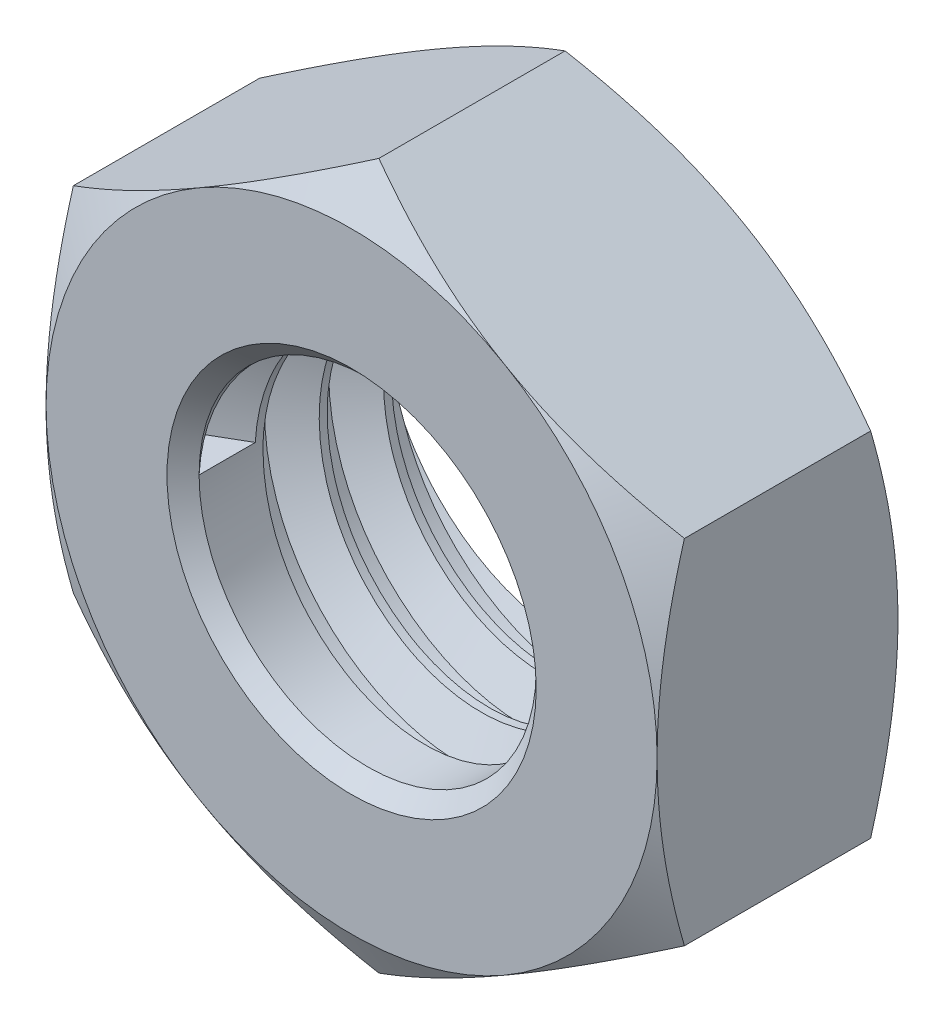
from build123d import *

# Parameters (mm, degrees)
BOSS_EXTRUDE1_DEPTH     = 3
SKETCH2_OUTSIDE_W       = 22.406
SKETCH2_OUTSIDE_H       = 23.584
SKETCH2_OUTSIDE_R       = 3.80618165
CUT_EXTRUDE1_DEPTH      = 3
CUT_EXTRUDE1_DRAFT      = -60
MIRROR1_COPY_1_SKETCH_W = 22.406
MIRROR1_COPY_1_SKETCH_H = 23.584
MIRROR1_COPY_1_SKETCH_R = 3.80618165
MIRROR1_COPY_1_DEPTH    = 3
MIRROR1_COPY_1_DRAFT    = -60
M5X0_8_TAPPED_HOLE1_D   = 4.2
CHAMFER1_SIZE           = 0.2
THREAD1_PITCH           = 0.8


with BuildPart() as part:
    # Sketch1 → Boss-Extrude1 (new body)
    with BuildSketch(Plane.XY):
        Polygon((3.80618165, -2.1975), (3.80618165, 2.1975), (0, 4.395), (-3.80618165, 2.1975), (-3.80618165, -2.1975), (0, -4.395), align=None)
    extrude(amount=BOSS_EXTRUDE1_DEPTH)


with BuildPart() as cut_extrude1_tool:
    # Sketch2 outside → Cut-Extrude1 (with draft: the straight prism first)
    with BuildSketch(Plane(origin=(0, 0, 0), x_dir=(-1, 0, 0), z_dir=(0, 0, -1))):
        Rectangle(SKETCH2_OUTSIDE_W, SKETCH2_OUTSIDE_H)
        Circle(SKETCH2_OUTSIDE_R, mode=Mode.SUBTRACT)
    extrude(amount=-CUT_EXTRUDE1_DEPTH)
    # Cut-Extrude1: the draft: its side faces are tilted about the plane it starts from
    cut_extrude1_sides = [cut_extrude1_tool.faces().sort_by_distance(p)[0] for p in [
        (0, -11.792, 1.5),
        (-11.203, 0, 1.5),
        (0, 11.792, 1.5),
        (11.203, 0, 1.5),
        (3.80618165, 0, 1.5),
    ]]
    draft(cut_extrude1_sides, Plane(origin=(0, 0, 0), x_dir=(-1, 0, 0), z_dir=(0, 0, -1)), CUT_EXTRUDE1_DRAFT)


with BuildPart() as part_1:
    add(part.part)

    # Cut-Extrude1: cut by cut_extrude1_tool
    add(cut_extrude1_tool.part, mode=Mode.SUBTRACT)


with BuildPart() as mirror1_copy_1_tool:
    # Mirror1 copy 1 sketch → Mirror1 copy 1 (with draft: the straight prism first)
    with BuildSketch(Plane(origin=(0, 0, 3), x_dir=(-1, 0, 0), z_dir=(0, 0, 1))):
        Rectangle(MIRROR1_COPY_1_SKETCH_W, MIRROR1_COPY_1_SKETCH_H)
        Circle(MIRROR1_COPY_1_SKETCH_R, mode=Mode.SUBTRACT)
    extrude(amount=-MIRROR1_COPY_1_DEPTH)
    # Mirror1 copy 1: the draft: its side faces are tilted about the plane it starts from
    mirror1_copy_1_sides = [mirror1_copy_1_tool.faces().sort_by_distance(p)[0] for p in [
        (0, -11.792, 1.5),
        (-11.203, 0, 1.5),
        (0, 11.792, 1.5),
        (11.203, 0, 1.5),
        (3.80618165, 0, 1.5),
    ]]
    draft(mirror1_copy_1_sides, Plane(origin=(0, 0, 3), x_dir=(-1, 0, 0), z_dir=(0, 0, 1)), MIRROR1_COPY_1_DRAFT)


with BuildPart() as part_2:
    add(part_1.part)

    # Mirror1 copy 1: cut by mirror1_copy_1_tool
    add(mirror1_copy_1_tool.part, mode=Mode.SUBTRACT)

    # M5x0.8 Tapped Hole1 (through all)
    with Locations(Plane(origin=(0, 0, 0), x_dir=(-1, 0, 0), z_dir=(0, 0, -1))):
        with Locations((0, 0)):
            Hole(M5X0_8_TAPPED_HOLE1_D / 2)

    # Chamfer1
    chamfer1_edges = [part_2.edges().sort_by_distance(p)[0] for p in [
        (-2.1, 0, 0),
        (-2.1, 0, 3),
    ]]
    chamfer(chamfer1_edges, length=CHAMFER1_SIZE)

    # Thread1: the profile of Thread Profile2 profile screwed along a right-hand helix of 3.5 turns, 8 arcs to a turn; built about Z, then put on its axis
    thread1_z = Axis((0, 0, 0), (0, 0, 1))
    thread1_corners = [(2.0997, 0, 0.700173208), (2.0997, 0, -0.000173205), (2.533012704, 0, 0.250000001), (2.533012704, 0, 0.450000001)]
    with BuildLine(mode=Mode.PRIVATE) as thread1_profile:
        Line(thread1_corners[0], thread1_corners[1])
        Line(thread1_corners[1], thread1_corners[2])
        Line(thread1_corners[2], thread1_corners[3])
        Line(thread1_corners[3], thread1_corners[0])
    thread1_cap = Face(thread1_profile.wire())
    thread1_turn_angles = [0, 22.5, 45, 67.5, 90, 112.5, 135, 157.5, 180, 202.5, 225, 247.5, 270, 292.5, 315, 337.5, 360]
    thread1_turn_weights = [1, 0.9238795325112867, 1, 0.9238795325112867, 1, 0.9238795325112867, 1, 0.9238795325112867, 1, 0.9238795325112867, 1, 0.9238795325112867, 1, 0.9238795325112867, 1, 0.9238795325112867, 1]
    thread1_turn_rails = [Edge.make_bspline([Vector(p[0], p[1], 0).rotate(thread1_z, thread1_turn_angles[k]) / thread1_turn_weights[k] + Vector(0, 0, p[2] + THREAD1_PITCH * thread1_turn_angles[k] / 360) for k in range(17)], [0, 0, 0, 1, 1, 2, 2, 3, 3, 4, 4, 5, 5, 6, 6, 7, 7, 8, 8, 8], 2, thread1_turn_weights) for p in thread1_corners]
    thread1_turn_sides = [Face.make_surface_from_curves(thread1_turn_rails[p[0]], thread1_turn_rails[p[1]]) for p in [(0, 1), (1, 2), (2, 3), (3, 0)]]
    thread1_last_angles = [1080, 1102.5, 1125, 1147.5, 1170, 1192.5, 1215, 1237.5, 1260]
    thread1_last_weights = [1, 0.9238795325112867, 1, 0.9238795325112867, 1, 0.9238795325112867, 1, 0.9238795325112845, 1]
    thread1_last_rails = [Edge.make_bspline([Vector(p[0], p[1], 0).rotate(thread1_z, thread1_last_angles[k]) / thread1_last_weights[k] + Vector(0, 0, p[2] + THREAD1_PITCH * thread1_last_angles[k] / 360) for k in range(9)], [0, 0, 0, 1, 1, 2, 2, 3, 3, 4, 4, 4], 2, thread1_last_weights) for p in thread1_corners]
    thread1_last_sides = [Face.make_surface_from_curves(thread1_last_rails[p[0]], thread1_last_rails[p[1]]) for p in [(0, 1), (1, 2), (2, 3), (3, 0)]]
    thread1 = Plane(origin=(0, 0, 2.8), x_dir=(-1, 0, 0), z_dir=(0, 0, -1)) * Solid(Shell([*[p.moved(Location((0, 0, THREAD1_PITCH * i))) for i in range(3) for p in thread1_turn_sides], *thread1_last_sides, thread1_cap, thread1_cap.rotate(thread1_z, 1260).moved(Location((0, 0, THREAD1_PITCH * 1260 / 360)))]))
    add(thread1, mode=Mode.SUBTRACT)


solid = part_2.part
